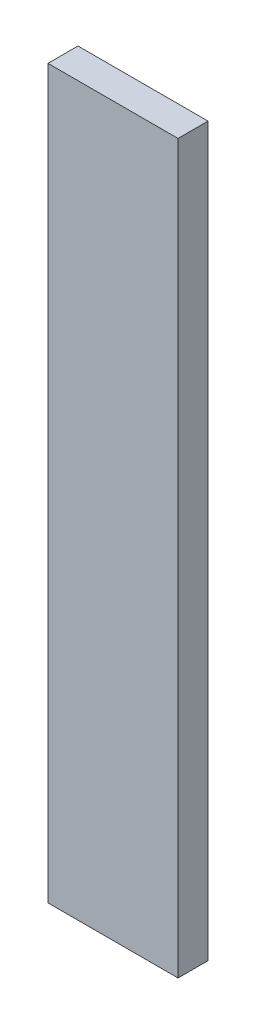
from build123d import *

# Parameters (mm, degrees)
SKETCH1_W   = 195
SKETCH1_H   = 45
SHAPE_DEPTH = 1090


with BuildPart() as part:
    # Sketch1 → Shape (new body)
    with BuildSketch(Plane(origin=(0, 0, 0), x_dir=(1, 0, 0), z_dir=(0, 1, 0))):
        Rectangle(SKETCH1_W, SKETCH1_H)
    extrude(amount=SHAPE_DEPTH)


solid = part.part
